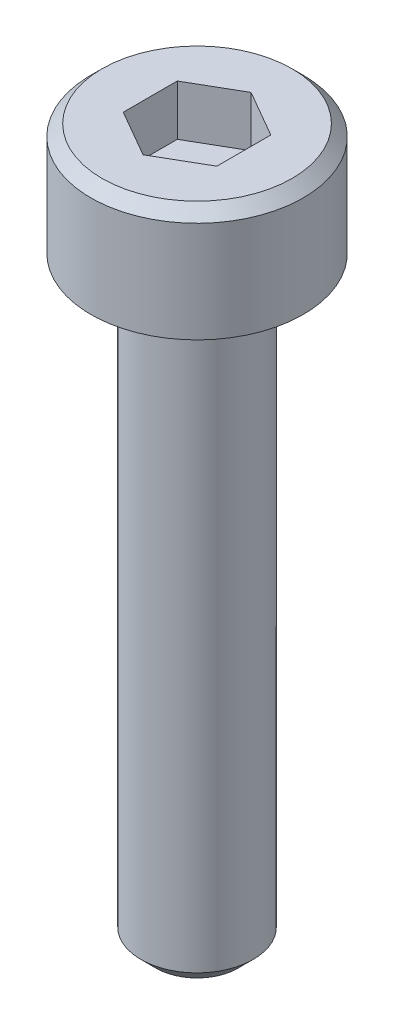
from build123d import *

# Parameters (mm, degrees)
CUT_EXTRUDE1_DEPTH = 1.35


with BuildPart() as part:
    # Sketch1 → Revolve1 (revolve)
    with BuildSketch(Plane.XY):
        Polygon((0, -16), (1.1, -16), (1.5, -15.6), (1.5, 0), (2.84, 0), (2.84, 2.7), (2.54, 3), (0, 3), align=None)
    revolve(axis=Axis((0, -10, 0), (0, 1, 0)))

    # Sketch2 → Cut-Extrude1 (cut)
    with BuildSketch(Plane(origin=(0, 3, 0), x_dir=(1, 0, 0), z_dir=(0, 1, 0))):
        Polygon((1.25, -0.721687836), (0, -1.443375673), (-1.25, -0.721687836), (-1.25, 0.721687836), (0, 1.443375673), (1.25, 0.721687836), align=None)
    extrude(amount=-CUT_EXTRUDE1_DEPTH, mode=Mode.SUBTRACT)


solid = part.part
